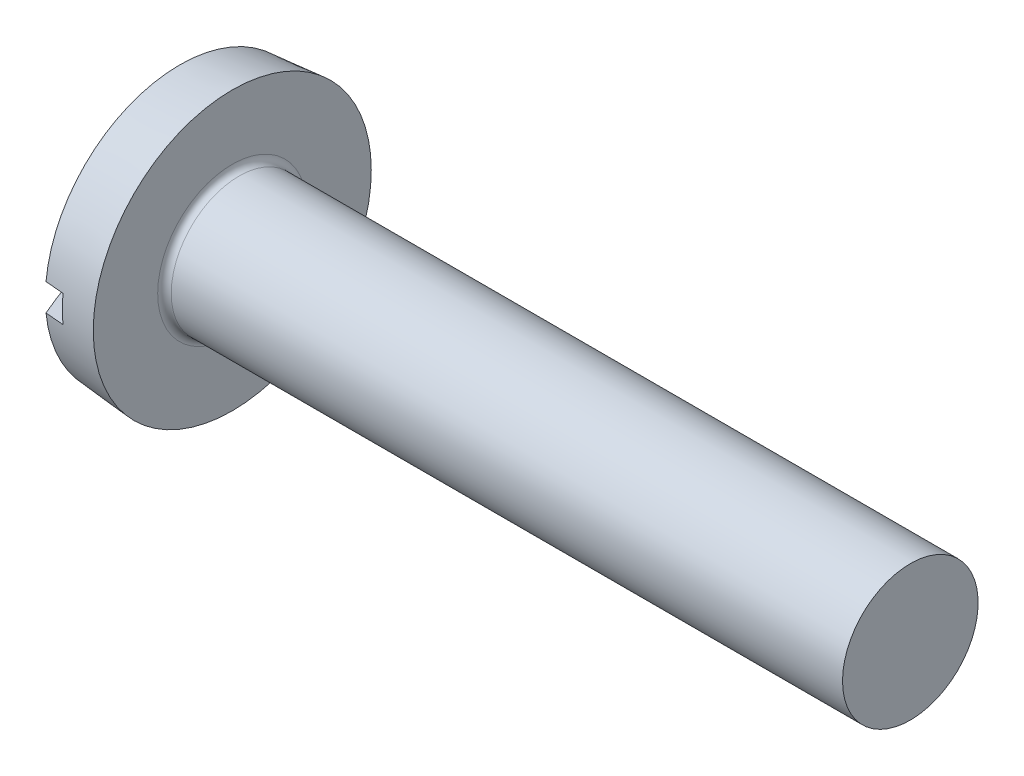
from build123d import *

# Parameters (mm, degrees)
FILLET1_R  = 0.4
SLOTSKE_W  = 16.4
SLOTSKE_H  = 1.6
SLOT_DEPTH = 2.8


with BuildPart() as part:
    # BodySke → BaseBody (revolve)
    with BuildSketch(Plane.XY):
        with BuildLine():
            Line((4.8, 8.2), (4.8, 4))
            Line((4.8, 4), (44.8, 4))
            Line((44.8, 4), (44.8, 0))
            Line((44.8, 0), (0, 0))
            ThreePointArc((0, 0), (0.42977528, 4.05449238), (1.7, 7.928785143))
            Line((1.7, 7.928785143), (4.8, 8.2))
        make_face()
    revolve(axis=Axis((0, 0, 0), (1, 0, 0)))

    # Fillet1
    fillet1_edges = [part.edges().sort_by_distance(p)[0] for p in [
        (4.8, -4, 0),
    ]]
    fillet(fillet1_edges, radius=FILLET1_R)

    # SlotSke → Slot (cut)
    with BuildSketch(Plane(origin=(0, 0, 0), x_dir=(0, 0, -1), z_dir=(1, 0, 0))):
        Rectangle(SLOTSKE_W, SLOTSKE_H)
    extrude(amount=SLOT_DEPTH, mode=Mode.SUBTRACT)


solid = part.part
